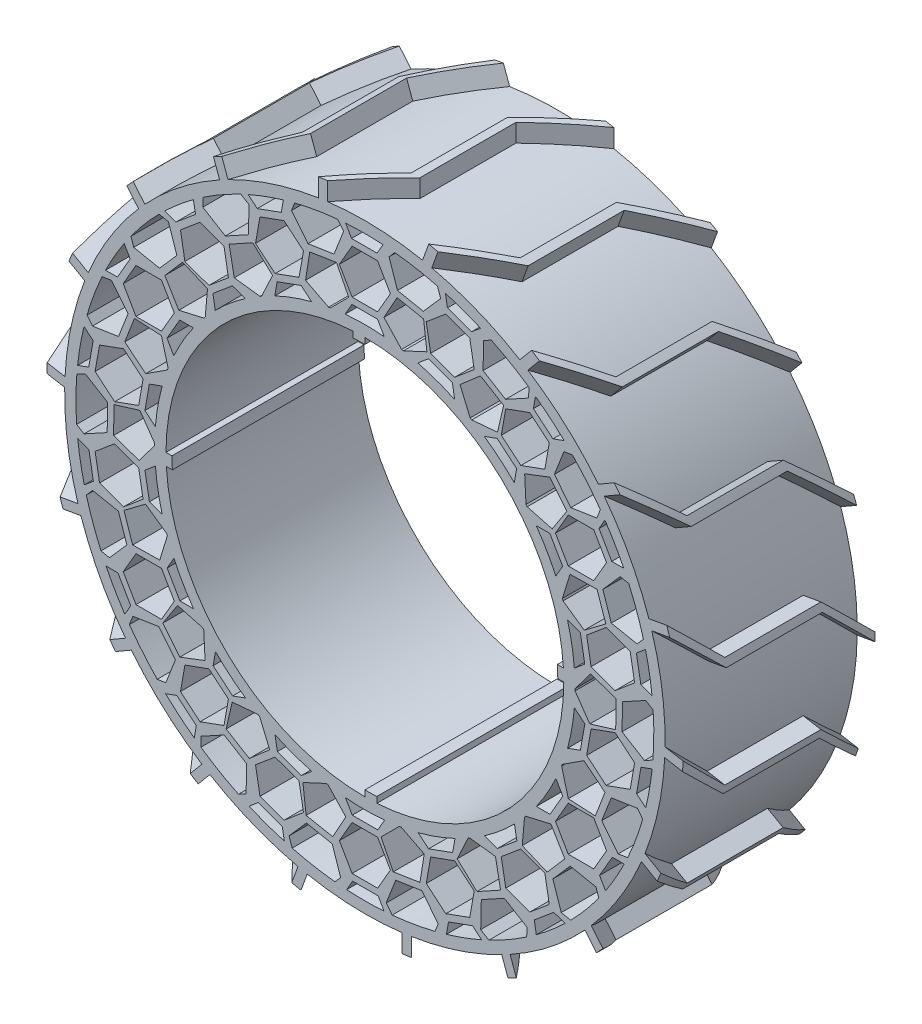
from build123d import *

# Parameters (mm, degrees)
SKETCH1_R           = 125
SKETCH1_R_2         = 82.8125
BOSS_EXTRUDE2_DEPTH = 80
BOSS_EXTRUDE3_START = 122
BOSS_EXTRUDE3_DEPTH = 12
CIRPATTERN1_COUNT   = 18
SKETCH5_R           = 140
SKETCH5_R_2         = 132.5
CUT_EXTRUDE1_DEPTH  = 208.071320045
BOSS_EXTRUDE4_START = 82.9
SKETCH6_W           = 5
SKETCH6_H           = 80
BOSS_EXTRUDE4_DEPTH = 3
CIRPATTERN2_COUNT   = 4
SKETCH7_R           = 80.3125
CUT_EXTRUDE3_DEPTH  = 80
SCALE1_SCALE        = 0.653


with BuildPart() as part:
    # Sketch1 → Boss-Extrude2 (new body)
    with BuildSketch(Plane.XY):
        Circle(SKETCH1_R)
        Circle(SKETCH1_R_2, mode=Mode.SUBTRACT)
        with BuildLine():
            Line((5.083032744, 115.764019915), (7.571414983, 120.074024382))
            ThreePointArc((7.571414983, 120.074024382), (-0.221644308, 120.312295839), (-8.013772799, 120.045312702))
            Line((-8.013772799, 120.045312702), (-5.541967256, 115.764019915))
            Line((-5.541967256, 115.764019915), (5.083032744, 115.764019915))
        make_face(mode=Mode.SUBTRACT)
        Polygon((5.3125, 94.704730085), (10.625, 103.90625), (5.3125, 113.107769915), (-5.3125, 113.107769915), (-10.625, 103.90625), (-5.3125, 94.704730085), align=None, mode=Mode.SUBTRACT)
        with BuildLine():
            Line((8.096172677, 87.124634794), (5.253389273, 92.048480085))
            Line((5.253389273, 92.048480085), (-5.371610727, 92.048480085))
            Line((-5.371610727, 92.048480085), (-8.221151588, 87.112930536))
            ThreePointArc((-8.221151588, 87.112930536), (-0.062762883, 87.49997749), (8.096172677, 87.124634794))
        make_face(mode=Mode.SUBTRACT)
        with BuildLine():
            Line((44.370115044, 107.044095679), (48.182537818, 110.243098223))
            ThreePointArc((48.182537818, 110.243098223), (40.940951146, 113.132383408), (33.527431892, 115.546566228))
            Line((33.527431892, 115.546566228), (34.385880948, 110.678059702))
            Line((34.385880948, 110.678059702), (44.370115044, 107.044095679))
        make_face(mode=Mode.SUBTRACT)
        Polygon((37.383042405, 87.176354003), (45.522264613, 94.005972356), (43.677252726, 104.469554731), (33.69301863, 108.103518754), (25.553796422, 101.273900401), (27.398808309, 90.810318026), align=None, mode=Mode.SUBTRACT)
        with BuildLine():
            Line((37.406293801, 79.101322265), (36.419005485, 84.700512538))
            Line((36.419005485, 84.700512538), (26.43477139, 88.334476561))
            Line((26.43477139, 88.334476561), (22.069021506, 84.671177444))
            ThreePointArc((22.069021506, 84.671177444), (29.867777025, 82.244549337), (37.406293801, 79.101322265))
        make_face(mode=Mode.SUBTRACT)
        with BuildLine():
            Line((78.305506637, 85.413073702), (82.982135493, 87.115227402))
            ThreePointArc((82.982135493, 87.115227402), (77.165463667, 92.307035882), (71.024733485, 97.11119858))
            Line((71.024733485, 97.11119858), (70.166284428, 92.242692055))
            Line((70.166284428, 92.242692055), (78.305506637, 85.413073702))
        make_face(mode=Mode.SUBTRACT)
        Polygon((64.944638181, 69.133223042), (74.928872277, 72.767187065), (76.773884165, 83.230769441), (68.634661957, 90.060387794), (58.650427861, 86.426423771), (56.805415973, 75.962841395), align=None, mode=Mode.SUBTRACT)
        with BuildLine():
            Line((62.204663834, 61.53722286), (63.191952149, 67.136413133))
            Line((63.191952149, 67.136413133), (55.052729941, 73.966031486))
            Line((55.052729941, 73.966031486), (49.697344902, 72.016830739))
            ThreePointArc((49.697344902, 72.016830739), (56.195822221, 67.069214733), (62.204663834, 61.53722286))
        make_face(mode=Mode.SUBTRACT)
        with BuildLine():
            Line((102.796098463, 53.479974473), (107.772862941, 53.479974473))
            ThreePointArc((107.772862941, 53.479974473), (104.08268243, 60.348097521), (99.955404006, 66.962787175))
            Line((99.955404006, 66.962787175), (97.483598463, 62.681494388))
            Line((97.483598463, 62.681494388), (102.796098463, 53.479974473))
        make_face(mode=Mode.SUBTRACT)
        Polygon((84.672952112, 42.751605085), (95.297952112, 42.751605085), (100.610452112, 51.953125), (95.297952112, 61.154644915), (84.672952112, 61.154644915), (79.360452112, 51.953125), align=None, mode=Mode.SUBTRACT)
        with BuildLine():
            Line((79.500233366, 36.550826185), (82.34301677, 41.474671476))
            Line((82.34301677, 41.474671476), (77.03051677, 50.676191391))
            Line((77.03051677, 50.676191391), (71.331435049, 50.676191391))
            ThreePointArc((71.331435049, 50.676191391), (75.745821896, 43.804342996), (79.500233366, 36.550826185))
        make_face(mode=Mode.SUBTRACT)
        with BuildLine():
            Line((114.887963705, 15.096401043), (119.564592561, 13.394247342))
            ThreePointArc((119.564592561, 13.394247342), (118.445993595, 21.110287957), (116.829977619, 28.737675372))
            Line((116.829977619, 28.737675372), (113.042951818, 25.559983418))
            Line((113.042951818, 25.559983418), (114.887963705, 15.096401043))
        make_face(mode=Mode.SUBTRACT)
        Polygon((94.188458378, 11.213512608), (104.172692474, 7.579548585), (112.311914682, 14.409166938), (110.466902795, 24.872749314), (100.482668699, 28.506713336), (92.343446491, 21.677094984), align=None, mode=Mode.SUBTRACT)
        with BuildLine():
            Line((87.206901455, 7.15586044), (91.562298314, 10.810472338))
            Line((91.562298314, 10.810472338), (89.717286427, 21.274054714))
            Line((89.717286427, 21.274054714), (84.361901388, 23.223255461))
            ThreePointArc((84.361901388, 23.223255461), (86.159757561, 15.25602101), (87.206901455, 7.15586044))
        make_face(mode=Mode.SUBTRACT)
        with BuildLine():
            Line((113.122644959, -25.108021153), (116.935067733, -28.307023696))
            ThreePointArc((116.935067733, -28.307023696), (118.522969855, -20.67373389), (119.613131705, -12.953624205))
            Line((119.613131705, -12.953624205), (114.967656847, -14.644438777))
            Line((114.967656847, -14.644438777), (113.122644959, -25.108021153))
        make_face(mode=Mode.SUBTRACT)
        Polygon((92.343446491, -21.677094984), (100.482668699, -28.506713336), (110.466902795, -24.872749314), (112.311914682, -14.409166938), (104.172692474, -7.579548585), (94.188458378, -11.213512608), align=None, mode=Mode.SUBTRACT)
        with BuildLine():
            Line((84.395130192, -23.102207684), (89.737815367, -21.157629309))
            Line((89.737815367, -21.157629309), (91.582827254, -10.694046934))
            Line((91.582827254, -10.694046934), (87.217077371, -7.030747817))
            ThreePointArc((87.217077371, -7.030747817), (86.181554881, -15.132402264), (84.395130192, -23.102207684))
        make_face(mode=Mode.SUBTRACT)
        with BuildLine():
            Line((97.713065719, -62.284045442), (100.201447958, -66.594049909))
            ThreePointArc((100.201447958, -66.594049909), (104.304326738, -59.964198318), (107.969176805, -53.082525527))
            Line((107.969176805, -53.082525527), (103.025565719, -53.082525527))
            Line((103.025565719, -53.082525527), (97.713065719, -62.284045442))
        make_face(mode=Mode.SUBTRACT)
        Polygon((79.360452112, -51.953125), (84.672952112, -61.154644915), (95.297952112, -61.154644915), (100.610452112, -51.953125), (95.297952112, -42.751605085), (84.672952112, -42.751605085), align=None, mode=Mode.SUBTRACT)
        with BuildLine():
            Line((71.404060688, -50.573808609), (77.089627497, -50.573808609))
            Line((77.089627497, -50.573808609), (82.402127497, -41.372288694))
            Line((82.402127497, -41.372288694), (79.552586636, -36.436739145))
            ThreePointArc((79.552586636, -36.436739145), (75.808584779, -43.695634494), (71.404060688, -50.573808609))
        make_face(mode=Mode.SUBTRACT)
        with BuildLine():
            Line((70.517848661, -91.947694637), (71.382054744, -96.84885088))
            ThreePointArc((71.382054744, -96.84885088), (77.505042449, -92.022095451), (83.302545727, -86.808890856))
            Line((83.302545727, -86.808890856), (78.65707087, -85.118076284))
            Line((78.65707087, -85.118076284), (70.517848661, -91.947694637))
        make_face(mode=Mode.SUBTRACT)
        Polygon((56.805415973, -75.962841395), (58.650427861, -86.426423771), (68.634661957, -90.060387794), (76.773884165, -83.230769441), (74.928872277, -72.767187065), (64.944638181, -69.133223042), align=None, mode=Mode.SUBTRACT)
        with BuildLine():
            Line((49.800607654, -71.945461825), (55.143292829, -73.8900402))
            Line((55.143292829, -73.8900402), (63.282515037, -67.060421847))
            Line((63.282515037, -67.060421847), (62.292879882, -61.447921983))
            ThreePointArc((62.292879882, -61.447921983), (56.291980536, -66.988528326), (49.800607654, -71.945461825))
        make_face(mode=Mode.SUBTRACT)
        with BuildLine():
            Line((34.817138323, -110.521094854), (33.95293224, -115.422251098))
            ThreePointArc((33.95293224, -115.422251098), (41.357506188, -112.980769772), (48.58839822, -110.064822785))
            Line((48.58839822, -110.064822785), (44.801372419, -106.887130832))
            Line((44.801372419, -106.887130832), (34.817138323, -110.521094854))
        make_face(mode=Mode.SUBTRACT)
        Polygon((27.398808309, -90.810318026), (25.553796422, -101.273900401), (33.69301863, -108.103518754), (43.677252726, -104.469554731), (45.522264613, -94.005972356), (37.383042405, -87.176354003), align=None, mode=Mode.SUBTRACT)
        with BuildLine():
            Line((22.190466358, -84.639430544), (26.545863218, -88.294042442))
            Line((26.545863218, -88.294042442), (36.530097313, -84.660078419))
            Line((36.530097313, -84.660078419), (37.519732469, -79.047578555))
            ThreePointArc((37.519732469, -79.047578555), (29.98573266, -82.201616997), (22.190466358, -84.639430544))
        make_face(mode=Mode.SUBTRACT)
        with BuildLine():
            Line((-5.083032744, -115.764019915), (-7.571414983, -120.074024382))
            ThreePointArc((-7.571414983, -120.074024382), (0.221644308, -120.312295839), (8.013772799, -120.045312702))
            Line((8.013772799, -120.045312702), (5.541967256, -115.764019915))
            Line((5.541967256, -115.764019915), (-5.083032744, -115.764019915))
        make_face(mode=Mode.SUBTRACT)
        Polygon((-5.3125, -94.704730085), (-10.625, -103.90625), (-5.3125, -113.107769915), (5.3125, -113.107769915), (10.625, -103.90625), (5.3125, -94.704730085), align=None, mode=Mode.SUBTRACT)
        with BuildLine():
            Line((-8.096172677, -87.124634794), (-5.253389273, -92.048480085))
            Line((-5.253389273, -92.048480085), (5.371610727, -92.048480085))
            Line((5.371610727, -92.048480085), (8.221151588, -87.112930536))
            ThreePointArc((8.221151588, -87.112930536), (0.062762883, -87.49997749), (-8.096172677, -87.124634794))
        make_face(mode=Mode.SUBTRACT)
        with BuildLine():
            Line((-44.370115044, -107.044095679), (-48.182537818, -110.243098223))
            ThreePointArc((-48.182537818, -110.243098223), (-40.940951146, -113.132383408), (-33.527431892, -115.546566228))
            Line((-33.527431892, -115.546566228), (-34.385880948, -110.678059702))
            Line((-34.385880948, -110.678059702), (-44.370115044, -107.044095679))
        make_face(mode=Mode.SUBTRACT)
        Polygon((-37.383042405, -87.176354003), (-45.522264613, -94.005972356), (-43.677252726, -104.469554731), (-33.69301863, -108.103518754), (-25.553796422, -101.273900401), (-27.398808309, -90.810318026), align=None, mode=Mode.SUBTRACT)
        with BuildLine():
            Line((-37.406293801, -79.101322265), (-36.419005485, -84.700512538))
            Line((-36.419005485, -84.700512538), (-26.43477139, -88.334476561))
            Line((-26.43477139, -88.334476561), (-22.069021506, -84.671177444))
            ThreePointArc((-22.069021506, -84.671177444), (-29.867777025, -82.244549337), (-37.406293801, -79.101322265))
        make_face(mode=Mode.SUBTRACT)
        with BuildLine():
            Line((-78.305506637, -85.413073702), (-82.982135493, -87.115227402))
            ThreePointArc((-82.982135493, -87.115227402), (-77.165463667, -92.307035882), (-71.024733485, -97.11119858))
            Line((-71.024733485, -97.11119858), (-70.166284428, -92.242692055))
            Line((-70.166284428, -92.242692055), (-78.305506637, -85.413073702))
        make_face(mode=Mode.SUBTRACT)
        Polygon((-64.944638181, -69.133223042), (-74.928872277, -72.767187065), (-76.773884165, -83.230769441), (-68.634661957, -90.060387794), (-58.650427861, -86.426423771), (-56.805415973, -75.962841395), align=None, mode=Mode.SUBTRACT)
        with BuildLine():
            Line((-62.204663834, -61.53722286), (-63.191952149, -67.136413133))
            Line((-63.191952149, -67.136413133), (-55.052729941, -73.966031486))
            Line((-55.052729941, -73.966031486), (-49.697344902, -72.016830739))
            ThreePointArc((-49.697344902, -72.016830739), (-56.195822221, -67.069214733), (-62.204663834, -61.53722286))
        make_face(mode=Mode.SUBTRACT)
        with BuildLine():
            Line((-102.796098463, -53.479974473), (-107.772862941, -53.479974473))
            ThreePointArc((-107.772862941, -53.479974473), (-104.08268243, -60.348097521), (-99.955404006, -66.962787175))
            Line((-99.955404006, -66.962787175), (-97.483598463, -62.681494388))
            Line((-97.483598463, -62.681494388), (-102.796098463, -53.479974473))
        make_face(mode=Mode.SUBTRACT)
        Polygon((-84.672952112, -42.751605085), (-95.297952112, -42.751605085), (-100.610452112, -51.953125), (-95.297952112, -61.154644915), (-84.672952112, -61.154644915), (-79.360452112, -51.953125), align=None, mode=Mode.SUBTRACT)
        with BuildLine():
            Line((-79.500233366, -36.550826185), (-82.34301677, -41.474671476))
            Line((-82.34301677, -41.474671476), (-77.03051677, -50.676191391))
            Line((-77.03051677, -50.676191391), (-71.331435049, -50.676191391))
            ThreePointArc((-71.331435049, -50.676191391), (-75.745821896, -43.804342996), (-79.500233366, -36.550826185))
        make_face(mode=Mode.SUBTRACT)
        with BuildLine():
            Line((-114.887963705, -15.096401043), (-119.564592561, -13.394247342))
            ThreePointArc((-119.564592561, -13.394247342), (-118.445993595, -21.110287957), (-116.829977619, -28.737675372))
            Line((-116.829977619, -28.737675372), (-113.042951818, -25.559983418))
            Line((-113.042951818, -25.559983418), (-114.887963705, -15.096401043))
        make_face(mode=Mode.SUBTRACT)
        Polygon((-94.188458378, -11.213512608), (-104.172692474, -7.579548585), (-112.311914682, -14.409166938), (-110.466902795, -24.872749314), (-100.482668699, -28.506713336), (-92.343446491, -21.677094984), align=None, mode=Mode.SUBTRACT)
        with BuildLine():
            Line((-87.206901455, -7.15586044), (-91.562298314, -10.810472338))
            Line((-91.562298314, -10.810472338), (-89.717286427, -21.274054714))
            Line((-89.717286427, -21.274054714), (-84.361901388, -23.223255461))
            ThreePointArc((-84.361901388, -23.223255461), (-86.159757561, -15.256021011), (-87.206901455, -7.15586044))
        make_face(mode=Mode.SUBTRACT)
        with BuildLine():
            Line((-113.122644959, 25.108021153), (-116.935067733, 28.307023696))
            ThreePointArc((-116.935067733, 28.307023696), (-118.522969855, 20.67373389), (-119.613131705, 12.953624205))
            Line((-119.613131705, 12.953624205), (-114.967656847, 14.644438777))
            Line((-114.967656847, 14.644438777), (-113.122644959, 25.108021153))
        make_face(mode=Mode.SUBTRACT)
        Polygon((-92.343446491, 21.677094984), (-100.482668699, 28.506713336), (-110.466902795, 24.872749314), (-112.311914682, 14.409166938), (-104.172692474, 7.579548585), (-94.188458378, 11.213512608), align=None, mode=Mode.SUBTRACT)
        with BuildLine():
            Line((-84.395130192, 23.102207684), (-89.737815367, 21.157629309))
            Line((-89.737815367, 21.157629309), (-91.582827254, 10.694046934))
            Line((-91.582827254, 10.694046934), (-87.217077371, 7.030747817))
            ThreePointArc((-87.217077371, 7.030747817), (-86.181554881, 15.132402264), (-84.395130192, 23.102207684))
        make_face(mode=Mode.SUBTRACT)
        with BuildLine():
            Line((-97.713065719, 62.284045442), (-100.201447958, 66.594049909))
            ThreePointArc((-100.201447958, 66.594049909), (-104.304326738, 59.964198318), (-107.969176805, 53.082525527))
            Line((-107.969176805, 53.082525527), (-103.025565719, 53.082525527))
            Line((-103.025565719, 53.082525527), (-97.713065719, 62.284045442))
        make_face(mode=Mode.SUBTRACT)
        Polygon((-79.360452112, 51.953125), (-84.672952112, 61.154644915), (-95.297952112, 61.154644915), (-100.610452112, 51.953125), (-95.297952112, 42.751605085), (-84.672952112, 42.751605085), align=None, mode=Mode.SUBTRACT)
        with BuildLine():
            Line((-71.404060688, 50.573808609), (-77.089627497, 50.573808609))
            Line((-77.089627497, 50.573808609), (-82.402127497, 41.372288694))
            Line((-82.402127497, 41.372288694), (-79.552586636, 36.436739145))
            ThreePointArc((-79.552586636, 36.436739145), (-75.808584779, 43.695634494), (-71.404060688, 50.573808609))
        make_face(mode=Mode.SUBTRACT)
        with BuildLine():
            Line((-70.517848661, 91.947694637), (-71.382054744, 96.84885088))
            ThreePointArc((-71.382054744, 96.84885088), (-77.505042449, 92.022095451), (-83.302545727, 86.808890856))
            Line((-83.302545727, 86.808890856), (-78.65707087, 85.118076284))
            Line((-78.65707087, 85.118076284), (-70.517848661, 91.947694637))
        make_face(mode=Mode.SUBTRACT)
        Polygon((-56.805415973, 75.962841395), (-58.650427861, 86.426423771), (-68.634661957, 90.060387794), (-76.773884165, 83.230769441), (-74.928872277, 72.767187065), (-64.944638181, 69.133223042), align=None, mode=Mode.SUBTRACT)
        with BuildLine():
            Line((-49.800607654, 71.945461825), (-55.143292829, 73.8900402))
            Line((-55.143292829, 73.8900402), (-63.282515037, 67.060421847))
            Line((-63.282515037, 67.060421847), (-62.292879882, 61.447921983))
            ThreePointArc((-62.292879882, 61.447921983), (-56.291980536, 66.988528326), (-49.800607654, 71.945461825))
        make_face(mode=Mode.SUBTRACT)
        with BuildLine():
            Line((-34.817138323, 110.521094854), (-33.95293224, 115.422251098))
            ThreePointArc((-33.95293224, 115.422251098), (-41.357506188, 112.980769772), (-48.58839822, 110.064822785))
            Line((-48.58839822, 110.064822785), (-44.801372419, 106.887130832))
            Line((-44.801372419, 106.887130832), (-34.817138323, 110.521094854))
        make_face(mode=Mode.SUBTRACT)
        Polygon((-27.398808309, 90.810318026), (-25.553796422, 101.273900401), (-33.69301863, 108.103518754), (-43.677252726, 104.469554731), (-45.522264613, 94.005972356), (-37.383042405, 87.176354003), align=None, mode=Mode.SUBTRACT)
        with BuildLine():
            Line((-22.190466358, 84.639430544), (-26.545863218, 88.294042442))
            Line((-26.545863218, 88.294042442), (-36.530097313, 84.660078419))
            Line((-36.530097313, 84.660078419), (-37.519732469, 79.047578555))
            ThreePointArc((-37.519732469, 79.047578555), (-29.98573266, 82.201616997), (-22.190466358, 84.639430544))
        make_face(mode=Mode.SUBTRACT)
        with BuildLine():
            Line((-14.334733538, 86.317816321), (-6.719076125, 93.922853203))
            Line((-6.719076125, 93.922853203), (-11.822203531, 103.955604809))
            Line((-11.822203531, 103.955604809), (-22.940870415, 102.202532982))
            Line((-22.940870415, 102.202532982), (-24.709457053, 91.086323403))
            Line((-24.709457053, 91.086323403), (-15.108206062, 86.18579993))
            ThreePointArc((-15.108206062, 86.18579993), (-14.721617783, 86.252675146), (-14.334733538, 86.317816321))
        make_face(mode=Mode.SUBTRACT)
        with BuildLine():
            Line((-8.867095883, 116.655785451), (-11.365248587, 119.774491361))
            ThreePointArc((-11.365248587, 119.774491361), (-20.354423913, 118.578223479), (-29.227961117, 116.708285675))
            Line((-29.227961117, 116.708285675), (-30.541142212, 113.340931307))
            Line((-30.541142212, 113.340931307), (-23.687256681, 104.784507481))
            Line((-23.687256681, 104.784507481), (-12.850233516, 106.441934553))
            Line((-12.850233516, 106.441934553), (-8.867095883, 116.655785451))
        make_face(mode=Mode.SUBTRACT)
        with BuildLine():
            Line((31.56628389, 112.653306165), (30.285448472, 116.438349641))
            ThreePointArc((30.285448472, 116.438349641), (21.429239038, 118.388704573), (12.451285211, 119.666466284))
            Line((12.451285211, 119.666466284), (10.065595603, 116.951322619))
            Line((10.065595603, 116.951322619), (13.579671958, 106.566747378))
            Line((13.579671958, 106.566747378), (24.330016101, 104.417739151))
            Line((24.330016101, 104.417739151), (31.56628389, 112.653306165))
        make_face(mode=Mode.SUBTRACT)
        with BuildLine():
            Line((16.052188583, 86.014982658), (25.809641461, 90.556671457))
            Line((25.809641461, 90.556671457), (24.445673436, 101.729746474))
            Line((24.445673436, 101.729746474), (13.397958335, 103.885205856))
            Line((13.397958335, 103.885205856), (7.934062929, 94.044277999))
            Line((7.934062929, 94.044277999), (15.280209895, 86.155471013))
            ThreePointArc((15.280209895, 86.155471013), (15.666356719, 86.086092182), (16.052188583, 86.014982658))
        make_face(mode=Mode.SUBTRACT)
        with BuildLine():
            Line((68.192303958, 95.06317557), (68.283273479, 99.058024507))
            ThreePointArc((68.283273479, 99.058024507), (60.628219499, 103.919760665), (52.628722782, 108.19110497))
            Line((52.628722782, 108.19110497), (49.458274036, 106.455658405))
            Line((49.458274036, 106.455658405), (49.208691743, 95.495464783))
            Line((49.208691743, 95.495464783), (58.575706704, 89.799223365))
            Line((58.575706704, 89.799223365), (68.192303958, 95.06317557))
        make_face(mode=Mode.SUBTRACT)
        with BuildLine():
            Line((44.502979856, 75.337472641), (55.225335377, 76.26801866))
            Line((55.225335377, 76.26801866), (57.765041408, 87.233779344))
            Line((57.765041408, 87.233779344), (48.120795578, 93.037789722))
            Line((48.120795578, 93.037789722), (39.620617827, 85.659104722))
            Line((39.620617827, 85.659104722), (43.825607027, 75.733520773))
            ThreePointArc((43.825607027, 75.733520773), (44.16473739, 75.536256005), (44.502979856, 75.337472641))
        make_face(mode=Mode.SUBTRACT)
        with BuildLine():
            Line((96.593325758, 66.007023018), (98.045127951, 69.729839677))
            ThreePointArc((98.045127951, 69.729839677), (92.514541912, 76.916559928), (86.458359668, 83.666299666))
            Line((86.458359668, 83.666299666), (82.885554694, 83.11987067))
            Line((82.885554694, 83.11987067), (78.902417061, 72.906019772))
            Line((78.902417061, 72.906019772), (85.756302593, 64.349595946))
            Line((85.756302593, 64.349595946), (96.593325758, 66.007023018))
        make_face(mode=Mode.SUBTRACT)
        with BuildLine():
            Line((67.586054964, 55.573151561), (77.980038807, 52.780317216))
            Line((77.980038807, 52.780317216), (84.117092864, 62.216130991))
            Line((84.117092864, 62.216130991), (77.039554686, 70.968643055))
            Line((77.039554686, 70.968643055), (66.528341478, 66.942179223))
            Line((66.528341478, 66.942179223), (67.084989154, 56.17699022))
            ThreePointArc((67.084989154, 56.17699022), (67.336198929, 55.875632558), (67.586054964, 55.573151561))
        make_face(mode=Mode.SUBTRACT)
        with BuildLine():
            Line((113.343766905, 28.989449331), (115.981293, 31.991207079))
            ThreePointArc((115.981293, 31.991207079), (113.2422452, 40.636086896), (109.859842389, 49.050103839))
            Line((109.859842389, 49.050103839), (106.315614196, 49.758599813))
            Line((106.315614196, 49.758599813), (99.079346406, 41.523032798))
            Line((99.079346406, 41.523032798), (102.593422761, 31.138457557))
            Line((102.593422761, 31.138457557), (113.343766905, 28.989449331))
        make_face(mode=Mode.SUBTRACT)
        with BuildLine():
            Line((82.51725438, 29.10588823), (91.329198695, 22.926530561))
            Line((91.329198695, 22.926530561), (100.323381485, 29.694299028))
            Line((100.323381485, 29.694299028), (96.666206516, 40.339630651))
            Line((96.666206516, 40.339630651), (85.411765292, 40.151038948))
            Line((85.411765292, 40.151038948), (82.25293152, 29.844685562))
            ThreePointArc((82.25293152, 29.844685562), (82.385921102, 29.475583188), (82.51725438, 29.10588823))
        make_face(mode=Mode.SUBTRACT)
        with BuildLine():
            Line((116.423276987, -11.524679785), (119.928402411, -9.606037233))
            ThreePointArc((119.928402411, -9.606037233), (120.31126244, -0.54569794), (120.010606758, 8.517741587))
            Line((120.010606758, 8.517741587), (116.922441574, 10.39570746))
            Line((116.922441574, 10.39570746), (107.305844319, 5.131755255))
            Line((107.305844319, 5.131755255), (107.056262026, -5.828438368))
            Line((107.056262026, -5.828438368), (116.423276987, -11.524679785))
        make_face(mode=Mode.SUBTRACT)
        with BuildLine():
            Line((87.495655092, -0.871974779), (93.662709344, -9.692534039))
            Line((93.662709344, -9.692534039), (104.429189684, -6.409103638))
            Line((104.429189684, -6.409103638), (104.6334872, 4.84506344))
            Line((104.6334872, 4.84506344), (93.993269669, 8.517090809))
            Line((93.993269669, 8.517090809), (87.499956421, -0.087328635))
            ThreePointArc((87.499956421, -0.087328635), (87.498685302, -0.479656528), (87.495655092, -0.871974779))
        make_face(mode=Mode.SUBTRACT)
        with BuildLine():
            Line((105.460421641, -50.648762433), (109.410376538, -50.044651684))
            ThreePointArc((109.410376538, -50.044651684), (112.868965825, -41.661663551), (115.686320785, -33.041986009))
            Line((115.686320785, -33.041986009), (113.426696906, -30.221060637))
            Line((113.426696906, -30.221060637), (102.589673742, -31.878487709))
            Line((102.589673742, -31.878487709), (98.606536109, -42.092338607))
            Line((98.606536109, -42.092338607), (105.460421641, -50.648762433))
        make_face(mode=Mode.SUBTRACT)
        with BuildLine():
            Line((81.920788502, -30.74466476), (84.699114932, -41.142535987))
            Line((84.699114932, -41.142535987), (95.939296396, -41.739473818))
            Line((95.939296396, -41.739473818), (99.980425101, -31.233889927))
            Line((99.980425101, -31.233889927), (91.23779853, -24.14414418))
            Line((91.23779853, -24.14414418), (82.193195216, -30.00880971))
            ThreePointArc((82.193195216, -30.00880971), (82.057816712, -30.377042588), (81.920788502, -30.74466476))
        make_face(mode=Mode.SUBTRACT)
        with BuildLine():
            Line((81.777483014, -83.663856835), (85.695844528, -84.447142562))
            ThreePointArc((85.695844528, -84.447142562), (91.813006163, -77.752617677), (97.408557177, -70.616362445))
            Line((97.408557177, -70.616362445), (96.250018593, -67.192722806))
            Line((96.250018593, -67.192722806), (85.499674449, -65.043714579))
            Line((85.499674449, -65.043714579), (78.26340666, -73.279281594))
            Line((78.26340666, -73.279281594), (81.777483014, -83.663856835))
        make_face(mode=Mode.SUBTRACT)
        with BuildLine():
            Line((66.465065797, -56.909094428), (65.519557234, -67.630140896))
            Line((65.519557234, -67.630140896), (75.877708049, -72.035447446))
            Line((75.877708049, -72.035447446), (83.268248181, -63.545575205))
            Line((83.268248181, -63.545575205), (77.477702363, -53.893239051))
            Line((77.477702363, -53.893239051), (66.972721625, -56.310785451))
            ThreePointArc((66.972721625, -56.310785451), (66.719564383, -56.610508994), (66.465065797, -56.909094428))
        make_face(mode=Mode.SUBTRACT)
        with BuildLine():
            Line((48.230973029, -106.587855356), (51.645128933, -108.66406174))
            ThreePointArc((51.645128933, -108.66406174), (59.683042941, -104.465458605), (67.381883976, -99.673363383))
            Line((67.381883976, -99.673363383), (67.464167537, -96.059950945))
            Line((67.464167537, -96.059950945), (58.097152576, -90.363709528))
            Line((58.097152576, -90.363709528), (48.480555322, -95.627661733))
            Line((48.480555322, -95.627661733), (48.230973029, -106.587855356))
        make_face(mode=Mode.SUBTRACT)
        with BuildLine():
            Line((42.992675236, -76.20944742), (38.437373967, -85.960552699))
            Line((38.437373967, -85.960552699), (46.664148276, -93.642882982))
            Line((46.664148276, -93.642882982), (56.512691622, -88.192726281))
            Line((56.512691622, -88.192726281), (54.372651841, -77.142013913))
            Line((54.372651841, -77.142013913), (43.674349394, -75.820849408))
            ThreePointArc((43.674349394, -75.820849408), (43.333947912, -76.015912534), (42.992675236, -76.20944742))
        make_face(mode=Mode.SUBTRACT)
        with BuildLine():
            Line((8.867095883, -116.655785451), (11.365248587, -119.774491361))
            ThreePointArc((11.365248587, -119.774491361), (20.354423913, -118.578223479), (29.227961117, -116.708285675))
            Line((29.227961117, -116.708285675), (30.541142212, -113.340931307))
            Line((30.541142212, -113.340931307), (23.687256681, -104.784507481))
            Line((23.687256681, -104.784507481), (12.850233516, -106.441934553))
            Line((12.850233516, -106.441934553), (8.867095883, -116.655785451))
        make_face(mode=Mode.SUBTRACT)
        with BuildLine():
            Line((14.334733538, -86.317816321), (6.719076125, -93.922853203))
            Line((6.719076125, -93.922853203), (11.822203531, -103.955604809))
            Line((11.822203531, -103.955604809), (22.940870415, -102.202532982))
            Line((22.940870415, -102.202532982), (24.709457053, -91.086323403))
            Line((24.709457053, -91.086323403), (15.108206062, -86.18579993))
            ThreePointArc((15.108206062, -86.18579993), (14.721617783, -86.252675146), (14.334733538, -86.317816321))
        make_face(mode=Mode.SUBTRACT)
        with BuildLine():
            Line((-31.56628389, -112.653306165), (-30.285448472, -116.438349641))
            ThreePointArc((-30.285448472, -116.438349641), (-21.429239038, -118.388704573), (-12.451285211, -119.666466284))
            Line((-12.451285211, -119.666466284), (-10.065595603, -116.951322619))
            Line((-10.065595603, -116.951322619), (-13.579671958, -106.566747378))
            Line((-13.579671958, -106.566747378), (-24.330016101, -104.417739151))
            Line((-24.330016101, -104.417739151), (-31.56628389, -112.653306165))
        make_face(mode=Mode.SUBTRACT)
        with BuildLine():
            Line((-16.052188583, -86.014982658), (-25.809641461, -90.556671457))
            Line((-25.809641461, -90.556671457), (-24.445673436, -101.729746474))
            Line((-24.445673436, -101.729746474), (-13.397958335, -103.885205856))
            Line((-13.397958335, -103.885205856), (-7.934062929, -94.044277999))
            Line((-7.934062929, -94.044277999), (-15.280209895, -86.155471013))
            ThreePointArc((-15.280209895, -86.155471013), (-15.666356719, -86.086092182), (-16.052188583, -86.014982658))
        make_face(mode=Mode.SUBTRACT)
        with BuildLine():
            Line((-68.192303958, -95.06317557), (-68.283273479, -99.058024507))
            ThreePointArc((-68.283273479, -99.058024507), (-60.628219499, -103.919760665), (-52.628722782, -108.19110497))
            Line((-52.628722782, -108.19110497), (-49.458274036, -106.455658405))
            Line((-49.458274036, -106.455658405), (-49.208691743, -95.495464783))
            Line((-49.208691743, -95.495464783), (-58.575706704, -89.799223365))
            Line((-58.575706704, -89.799223365), (-68.192303958, -95.06317557))
        make_face(mode=Mode.SUBTRACT)
        with BuildLine():
            Line((-44.502979856, -75.337472641), (-55.225335377, -76.26801866))
            Line((-55.225335377, -76.26801866), (-57.765041408, -87.233779344))
            Line((-57.765041408, -87.233779344), (-48.120795578, -93.037789722))
            Line((-48.120795578, -93.037789722), (-39.620617827, -85.659104722))
            Line((-39.620617827, -85.659104722), (-43.825607027, -75.733520773))
            ThreePointArc((-43.825607027, -75.733520773), (-44.16473739, -75.536256005), (-44.502979856, -75.337472641))
        make_face(mode=Mode.SUBTRACT)
        with BuildLine():
            Line((-96.593325758, -66.007023018), (-98.045127951, -69.729839677))
            ThreePointArc((-98.045127951, -69.729839677), (-92.514541912, -76.916559928), (-86.458359668, -83.666299666))
            Line((-86.458359668, -83.666299666), (-82.885554694, -83.11987067))
            Line((-82.885554694, -83.11987067), (-78.902417061, -72.906019772))
            Line((-78.902417061, -72.906019772), (-85.756302593, -64.349595946))
            Line((-85.756302593, -64.349595946), (-96.593325758, -66.007023018))
        make_face(mode=Mode.SUBTRACT)
        with BuildLine():
            Line((-67.586054964, -55.573151561), (-77.980038807, -52.780317216))
            Line((-77.980038807, -52.780317216), (-84.117092864, -62.216130991))
            Line((-84.117092864, -62.216130991), (-77.039554686, -70.968643055))
            Line((-77.039554686, -70.968643055), (-66.528341478, -66.942179223))
            Line((-66.528341478, -66.942179223), (-67.084989154, -56.17699022))
            ThreePointArc((-67.084989154, -56.17699022), (-67.336198929, -55.875632558), (-67.586054964, -55.573151561))
        make_face(mode=Mode.SUBTRACT)
        with BuildLine():
            Line((-113.343766905, -28.989449331), (-115.981293, -31.991207079))
            ThreePointArc((-115.981293, -31.991207079), (-113.2422452, -40.636086896), (-109.859842389, -49.050103839))
            Line((-109.859842389, -49.050103839), (-106.315614196, -49.758599813))
            Line((-106.315614196, -49.758599813), (-99.079346406, -41.523032798))
            Line((-99.079346406, -41.523032798), (-102.593422761, -31.138457557))
            Line((-102.593422761, -31.138457557), (-113.343766905, -28.989449331))
        make_face(mode=Mode.SUBTRACT)
        with BuildLine():
            Line((-82.51725438, -29.10588823), (-91.329198695, -22.926530561))
            Line((-91.329198695, -22.926530561), (-100.323381485, -29.694299028))
            Line((-100.323381485, -29.694299028), (-96.666206516, -40.339630651))
            Line((-96.666206516, -40.339630651), (-85.411765292, -40.151038948))
            Line((-85.411765292, -40.151038948), (-82.25293152, -29.844685562))
            ThreePointArc((-82.25293152, -29.844685562), (-82.385921102, -29.475583188), (-82.51725438, -29.10588823))
        make_face(mode=Mode.SUBTRACT)
        with BuildLine():
            Line((-116.423276987, 11.524679785), (-119.928402411, 9.606037233))
            ThreePointArc((-119.928402411, 9.606037233), (-120.31126244, 0.54569794), (-120.010606758, -8.517741587))
            Line((-120.010606758, -8.517741587), (-116.922441574, -10.39570746))
            Line((-116.922441574, -10.39570746), (-107.305844319, -5.131755255))
            Line((-107.305844319, -5.131755255), (-107.056262026, 5.828438368))
            Line((-107.056262026, 5.828438368), (-116.423276987, 11.524679785))
        make_face(mode=Mode.SUBTRACT)
        with BuildLine():
            Line((-87.495655092, 0.871974779), (-93.662709344, 9.692534039))
            Line((-93.662709344, 9.692534039), (-104.429189684, 6.409103638))
            Line((-104.429189684, 6.409103638), (-104.6334872, -4.84506344))
            Line((-104.6334872, -4.84506344), (-93.993269669, -8.517090809))
            Line((-93.993269669, -8.517090809), (-87.499956421, 0.087328635))
            ThreePointArc((-87.499956421, 0.087328635), (-87.498685302, 0.479656528), (-87.495655092, 0.871974779))
        make_face(mode=Mode.SUBTRACT)
        with BuildLine():
            Line((-105.460421641, 50.648762433), (-109.410376538, 50.044651684))
            ThreePointArc((-109.410376538, 50.044651684), (-112.868965825, 41.661663551), (-115.686320785, 33.041986009))
            Line((-115.686320785, 33.041986009), (-113.426696906, 30.221060637))
            Line((-113.426696906, 30.221060637), (-102.589673742, 31.878487709))
            Line((-102.589673742, 31.878487709), (-98.606536109, 42.092338607))
            Line((-98.606536109, 42.092338607), (-105.460421641, 50.648762433))
        make_face(mode=Mode.SUBTRACT)
        with BuildLine():
            Line((-81.920788502, 30.74466476), (-84.699114932, 41.142535987))
            Line((-84.699114932, 41.142535987), (-95.939296396, 41.739473818))
            Line((-95.939296396, 41.739473818), (-99.980425101, 31.233889927))
            Line((-99.980425101, 31.233889927), (-91.23779853, 24.14414418))
            Line((-91.23779853, 24.14414418), (-82.193195216, 30.00880971))
            ThreePointArc((-82.193195216, 30.00880971), (-82.057816712, 30.377042588), (-81.920788502, 30.74466476))
        make_face(mode=Mode.SUBTRACT)
        with BuildLine():
            Line((-81.777483014, 83.663856835), (-85.695844528, 84.447142562))
            ThreePointArc((-85.695844528, 84.447142562), (-91.813006163, 77.752617677), (-97.408557177, 70.616362445))
            Line((-97.408557177, 70.616362445), (-96.250018593, 67.192722806))
            Line((-96.250018593, 67.192722806), (-85.499674449, 65.043714579))
            Line((-85.499674449, 65.043714579), (-78.26340666, 73.279281594))
            Line((-78.26340666, 73.279281594), (-81.777483014, 83.663856835))
        make_face(mode=Mode.SUBTRACT)
        with BuildLine():
            Line((-66.465065797, 56.909094428), (-65.519557234, 67.630140896))
            Line((-65.519557234, 67.630140896), (-75.877708049, 72.035447446))
            Line((-75.877708049, 72.035447446), (-83.268248181, 63.545575205))
            Line((-83.268248181, 63.545575205), (-77.477702363, 53.893239051))
            Line((-77.477702363, 53.893239051), (-66.972721625, 56.310785451))
            ThreePointArc((-66.972721625, 56.310785451), (-66.719564383, 56.610508994), (-66.465065797, 56.909094428))
        make_face(mode=Mode.SUBTRACT)
        with BuildLine():
            Line((-48.230973029, 106.587855356), (-51.645128933, 108.66406174))
            ThreePointArc((-51.645128933, 108.66406174), (-59.683042941, 104.465458605), (-67.381883976, 99.673363383))
            Line((-67.381883976, 99.673363383), (-67.464167537, 96.059950945))
            Line((-67.464167537, 96.059950945), (-58.097152576, 90.363709528))
            Line((-58.097152576, 90.363709528), (-48.480555322, 95.627661733))
            Line((-48.480555322, 95.627661733), (-48.230973029, 106.587855356))
        make_face(mode=Mode.SUBTRACT)
        with BuildLine():
            Line((-42.992675236, 76.20944742), (-38.437373967, 85.960552699))
            Line((-38.437373967, 85.960552699), (-46.664148276, 93.642882982))
            Line((-46.664148276, 93.642882982), (-56.512691622, 88.192726281))
            Line((-56.512691622, 88.192726281), (-54.372651841, 77.142013913))
            Line((-54.372651841, 77.142013913), (-43.674349394, 75.820849408))
            ThreePointArc((-43.674349394, 75.820849408), (-43.333947912, 76.015912534), (-42.992675236, 76.20944742))
        make_face(mode=Mode.SUBTRACT)
    extrude(amount=BOSS_EXTRUDE2_DEPTH)

    # Sketch3 → Boss-Extrude3 (add)
    with BuildSketch(Plane(origin=(0, 0, 0), x_dir=(1, 0, 0), z_dir=(0, 1, 0)).offset(BOSS_EXTRUDE3_START)):
        Polygon((0, -20.603532572), (0, -60.603532572), (-19.396467428, -80), (-15.504579204, -80), (3.5, -60.603532572), (3.5, -20.603532572), (23.687256681, 0), (20.187256681, 0), align=None)
    boss_extrude3 = extrude(amount=BOSS_EXTRUDE3_DEPTH)

    # CirPattern1: Boss-Extrude3 ×18 about axis
    cirpattern1_axis = Axis((0, 0, 0), (0, 0, 1))
    for i in range(1, CIRPATTERN1_COUNT):
        add(boss_extrude3.rotate(cirpattern1_axis, i * 360 / CIRPATTERN1_COUNT))

    # Sketch5 → Cut-Extrude1 (cut, through all)
    with BuildSketch(Plane.XY):
        Circle(SKETCH5_R)
        Circle(SKETCH5_R_2, mode=Mode.SUBTRACT)
    extrude(amount=CUT_EXTRUDE1_DEPTH, mode=Mode.SUBTRACT)

    # Sketch6 → Boss-Extrude4 (add)
    with BuildSketch(Plane(origin=(0, 0, 0), x_dir=(1, 0, 0), z_dir=(0, 1, 0)).offset(BOSS_EXTRUDE4_START)):
        with Locations((-2.5, -40)):
            Rectangle(SKETCH6_W, SKETCH6_H)
    boss_extrude4 = extrude(amount=-BOSS_EXTRUDE4_DEPTH)

    # CirPattern2: Boss-Extrude4 ×4 about axis
    cirpattern2_axis = Axis((0, 0, 0), (0, 0, 1))
    for i in range(1, CIRPATTERN2_COUNT):
        add(boss_extrude4.rotate(cirpattern2_axis, i * 360 / CIRPATTERN2_COUNT))

    # Sketch7 → Cut-Extrude3 (cut)
    with BuildSketch(Plane.XY):
        Circle(SKETCH7_R)
    extrude(amount=CUT_EXTRUDE3_DEPTH, mode=Mode.SUBTRACT)


with BuildPart() as part_1:
    # Scale1: scaled about (0, 0, 40.016266771)
    add(part.part.scale(SCALE1_SCALE).moved(Location((0, 0, 13.88564457))))


solid = part_1.part
